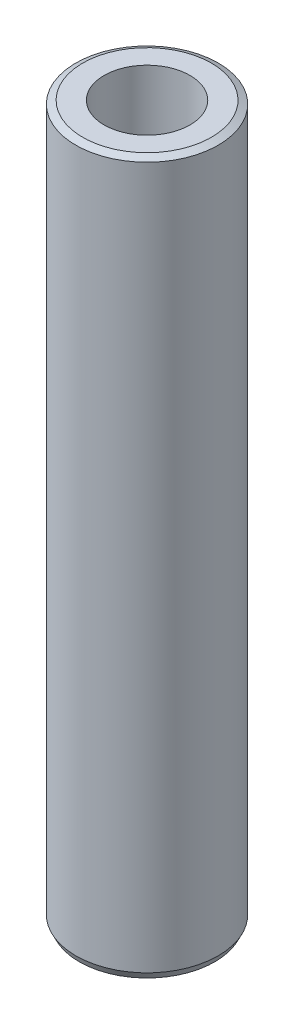
from build123d import *
from OCP.BRepFilletAPI import BRepFilletAPI_MakeChamfer

# Parameters (mm, degrees)
SKETCH1_R           = 60
BOSS_EXTRUDE1_DEPTH = 600
SKETCH2_R           = 36.167207382
CUT_EXTRUDE1_DEPTH  = 606.970296302
CHAMFER1_SIZE       = 2.847951839
CHAMFER1_SIZE2      = 5.804335002


with BuildPart() as part:
    # Sketch1 → Boss-Extrude1 (new body)
    with BuildSketch(Plane(origin=(0, 0, 0), x_dir=(1, 0, 0), z_dir=(0, 1, 0))):
        Circle(SKETCH1_R)
    extrude(amount=BOSS_EXTRUDE1_DEPTH)

    # Sketch2 → Cut-Extrude1 (cut, through all)
    with BuildSketch(Plane(origin=(0, 0, 0), x_dir=(1, 0, 0), z_dir=(0, 1, 0))):
        Circle(SKETCH2_R)
    extrude(amount=CUT_EXTRUDE1_DEPTH, mode=Mode.SUBTRACT)

    # Chamfer1: one chamfer whose edges measure the first distance from different faces: ONE call of the kernel's chamfer builder (chamfer() names one face for all edges)
    chamfer1_edges_1 = [part.edges().sort_by_distance(p)[0] for p in [
        (-60, 600, 0),
    ]]
    chamfer1_side_1 = [part.faces().sort_by_distance(p)[0] for p in [
        (-60, 300, 0),
    ]]
    chamfer1_edges_2 = [part.edges().sort_by_distance(p)[0] for p in [
        (-60, 0, 0),
    ]]
    chamfer1_side_2 = [part.faces().sort_by_distance(p)[0] for p in [
        (-58.302943725, 0, 0),
    ]]
    chamfer1 = BRepFilletAPI_MakeChamfer(part.part.solid().wrapped)
    for e in chamfer1_edges_1:
        chamfer1.Add(CHAMFER1_SIZE, CHAMFER1_SIZE2, e.wrapped, chamfer1_side_1[0].wrapped)  # the first distance lies on this face
    for e in chamfer1_edges_2:
        chamfer1.Add(CHAMFER1_SIZE, CHAMFER1_SIZE2, e.wrapped, chamfer1_side_2[0].wrapped)  # the first distance lies on this face
    add(Compound.cast(chamfer1.Shape()), mode=Mode.REPLACE)


solid = part.part
